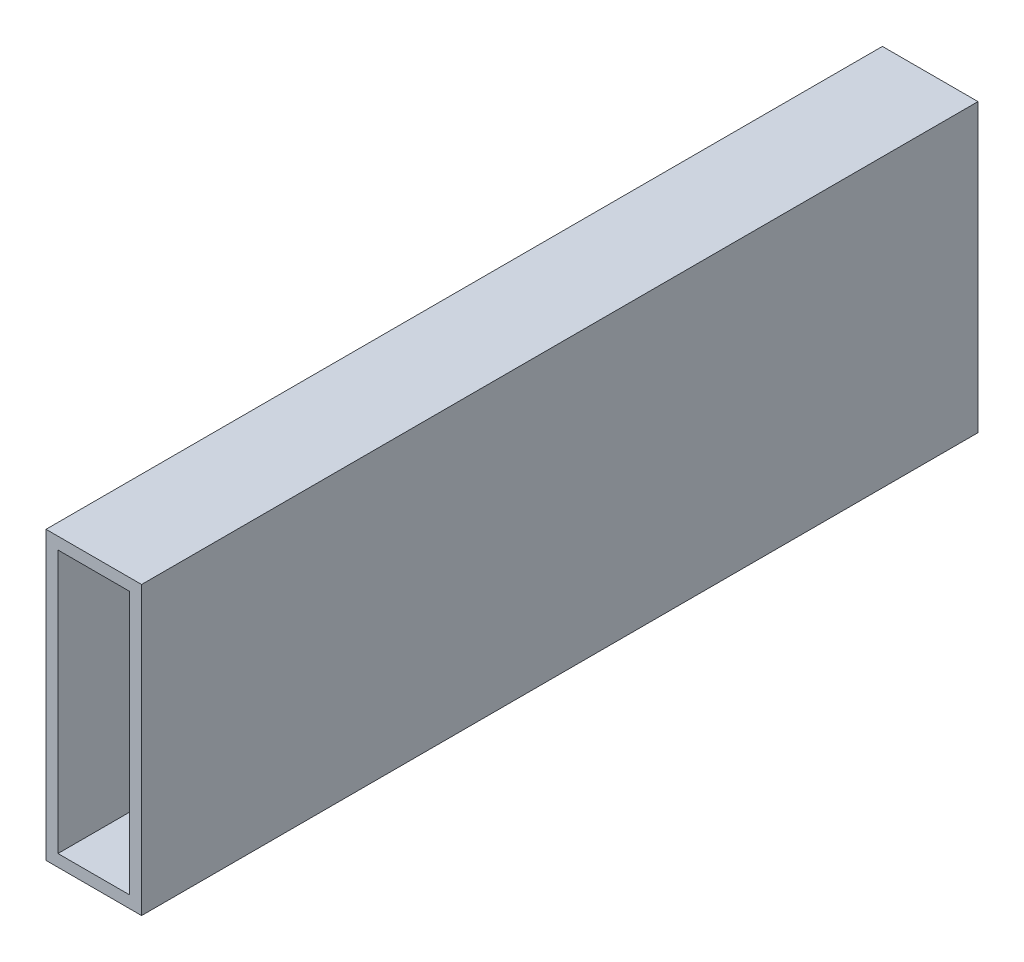
from build123d import *

# Parameters (mm, degrees)
SKETCH1_W           = 25.4
SKETCH1_H           = 76.2
SKETCH1_W_2         = 19.05
SKETCH1_H_2         = 69.85
BOSS_EXTRUDE1_DEPTH = 222.25


with BuildPart() as part:
    # Sketch1 → Boss-Extrude1 (new body)
    with BuildSketch(Plane.XY):
        Rectangle(SKETCH1_W, SKETCH1_H)
        Rectangle(SKETCH1_W_2, SKETCH1_H_2, mode=Mode.SUBTRACT)
    extrude(amount=BOSS_EXTRUDE1_DEPTH)


solid = part.part
